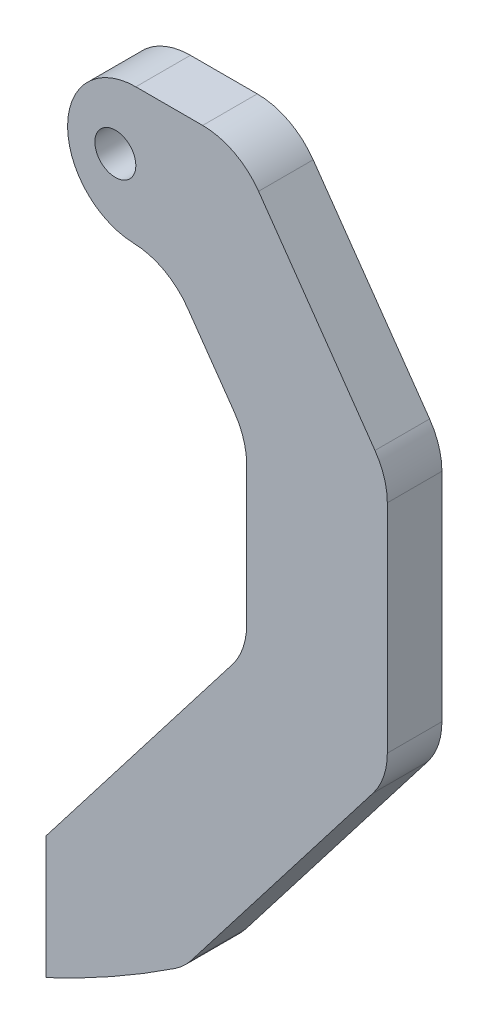
from build123d import *

# Parameters (mm, degrees)
SKETCH1_R           = 3
BOSS_EXTRUDE1_DEPTH = 8
FILLET1_R           = 10
FILLET2_R           = 10


with BuildPart() as part:
    # Sketch1 → Boss-Extrude1 (new body)
    with BuildSketch(Plane.XY):
        with BuildLine():
            Line((10.147551644, -27.873187436), (35.147551644, -27.873187436))
            Line((35.147551644, -27.873187436), (56.997626327, -59.078328042))
            Line((56.997626327, -59.078328042), (56.997626327, -97.413556574))
            Line((56.997626327, -97.413556574), (27.269645082, -135.957207253))
            ThreePointArc((27.269645082, -135.957207253), (17.360823002, -142.124386911), (6.997626327, -147.49309389))
            Line((6.997626327, -147.49309389), (6.997626327, -129.49309389))
            Line((6.997626327, -129.49309389), (36.388859372, -91.386052238))
            Line((36.388859372, -91.386052238), (36.388859372, -64.514894506))
            Line((36.388859372, -64.514894506), (24.736210633, -47.873187436))
            Line((24.736210633, -47.873187436), (10.147551644, -47.873187436))
            Line((10.147551644, -47.873187436), (10.147551644, -27.873187436))
        make_face()
        with Locations((17.147551644, -37.873187436)):
            Circle(SKETCH1_R, mode=Mode.SUBTRACT)
    extrude(amount=BOSS_EXTRUDE1_DEPTH)

    # Fillet1
    fillet1_edges = [part.edges().sort_by_distance(p)[0] for p in [
        (35.147551644, -27.873187436, 4),
        (56.997626327, -59.078328042, 4),
        (56.997626327, -97.413556574, 4),
        (27.269645082, -135.957207253, 4),
        (36.388859372, -91.386052238, 4),
        (36.388859372, -64.514894506, 4),
        (24.736210633, -47.873187436, 4),
    ]]
    fillet(fillet1_edges, radius=FILLET1_R)

    # Fillet2
    fillet2_edges = [part.edges().sort_by_distance(p)[0] for p in [
        (10.147551644, -27.873187436, 4),
        (10.147551644, -47.873187436, 4),
    ]]
    fillet(fillet2_edges, radius=FILLET2_R)


solid = part.part
